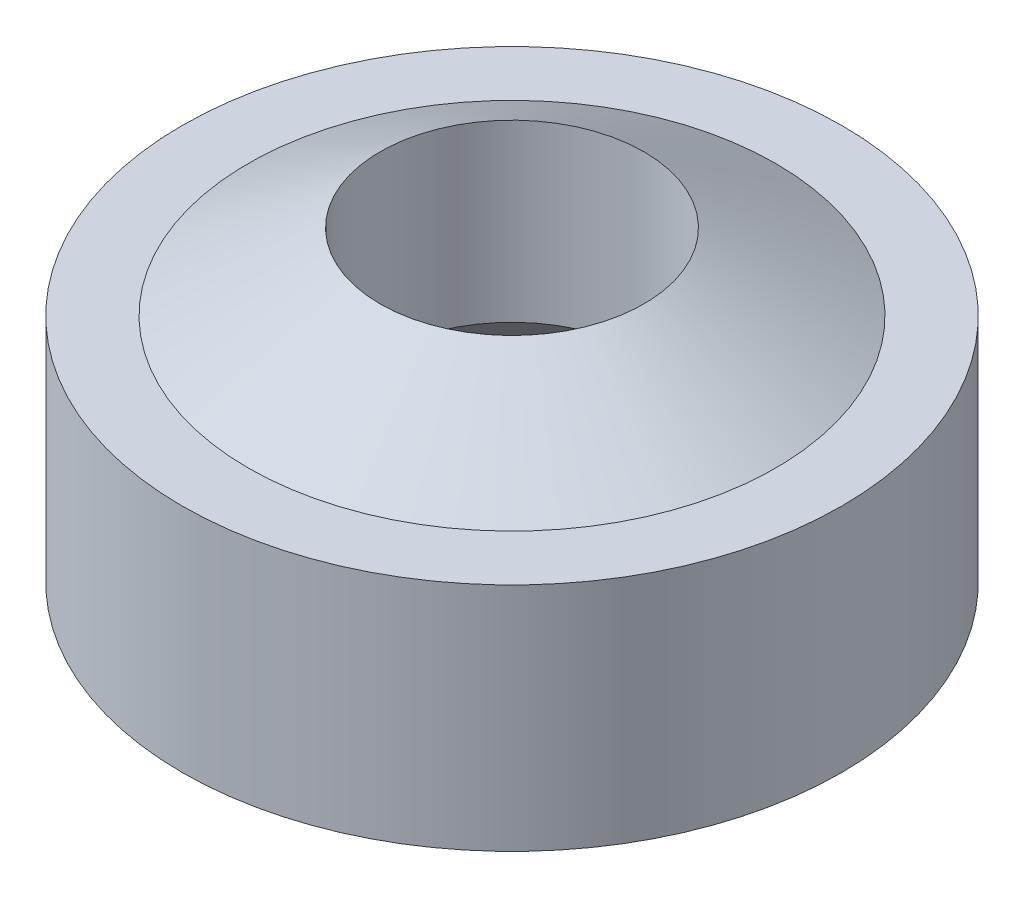
from build123d import *

# Parameters (mm, degrees)
CHAMFER6_SIZE   = 4
CHAMFER6_SIZE_2 = 6.92820323
CHAMFER4_SIZE   = 2


with BuildPart() as part:
    # Sketch3 → Revolve2 (revolve)
    with BuildSketch(Plane.XY, mode=Mode.PRIVATE) as revolve2_sk:
        Polygon((8, 6), (8, 10), (4, 10), (4, 6), (4, 3), (7, 3), (7, 1), (7, -1), (10, -1), (10, 6), align=None)
    revolve(revolve2_sk.sketch.rotate(Axis((0, 50.624065585, 0), (0, -1, 0)), 90), axis=Axis((0, 50.624065585, 0), (0, -1, 0)))

    # Chamfer6
    # the kernel refuses this chamfer: 6.92820323, 4 mm, written as the material it takes off along each edge
    with BuildSketch(Plane(origin=(0, 10, 0), x_dir=(0, 0, 1), z_dir=(1, 0, 0))) as chamfer6_piece_1_section:
        Polygon((8, CHAMFER6_SIZE), (8 - CHAMFER6_SIZE_2, 0), (8, 0), align=None)
    chamfer6_piece_1 = revolve(axis=Axis((0, 10, 0), (0, -1, 0)), mode=Mode.PRIVATE)
    chamfer6_piece_1 = split(chamfer6_piece_1, bisect_by=Plane(origin=(0, 6, -4.457093256), z_dir=(0, 1, 0)), keep=Keep.TOP, mode=Mode.PRIVATE)
    add(chamfer6_piece_1, mode=Mode.SUBTRACT)

    # Chamfer4
    chamfer4_edges = [part.edges().sort_by_distance(p)[0] for p in [
        (0, -1, -7),
    ]]
    chamfer(chamfer4_edges, length=CHAMFER4_SIZE)


solid = part.part
